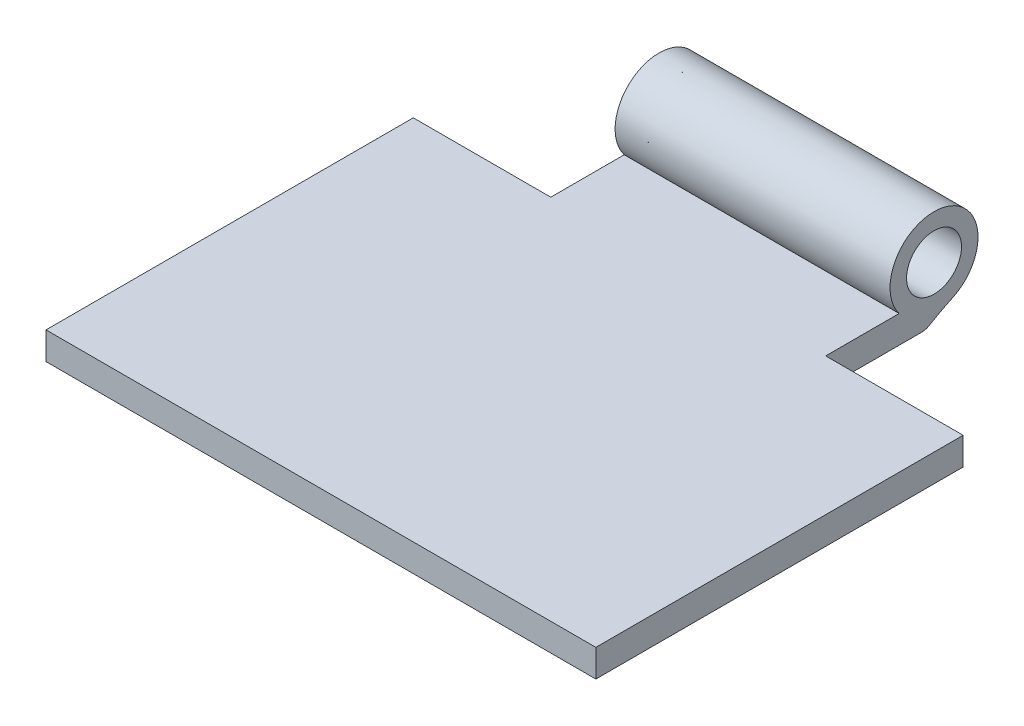
from build123d import *

# Parameters (mm, degrees)
SKETCH1_W           = 20
SKETCH1_H           = 17
BOSS_EXTRUDE1_DEPTH = 1
SKETCH2_R           = 1.6
SKETCH2_R_2         = 1
BOSS_EXTRUDE2_DEPTH = 20
FILLET1_R           = 10
FILLET2_R           = 0.5
SKETCH4_W           = 10
SKETCH4_H           = 12
CUT_EXTRUDE3_DEPTH  = 15.86420015


with BuildPart() as part:
    # Sketch1 → Boss-Extrude1 (new body)
    with BuildSketch(Plane(origin=(0, 0, 0), x_dir=(1, 0, 0), z_dir=(0, 1, 0))):
        Rectangle(SKETCH1_W, SKETCH1_H)
    extrude(amount=BOSS_EXTRUDE1_DEPTH)

    # Sketch2 → Boss-Extrude2 (add)
    with BuildSketch(Plane(origin=(10, 0, 0), x_dir=(0, 0, -1), z_dir=(1, 0, 0))):
        with Locations((8.800384095, 1.974416987)):
            Circle(SKETCH2_R)
        with Locations((8.800384095, 1.974416987)):
            Circle(SKETCH2_R_2, mode=Mode.SUBTRACT)
    extrude(amount=-BOSS_EXTRUDE2_DEPTH)

    # Fillet1
    # the kernel refuses this fillet: 10 mm, written as the material it adds along each edge
    with BuildSketch(Plane(origin=(-10, 0.402866989, -8.5), x_dir=(0, -1, 0), z_dir=(1, 0, 0))) as fillet1_piece_1:
        with BuildLine():
            CenterArc((8.937605274, 5.21135706), FILLET1_R, 205.046884286, 6.361578996)
            Line((-0.12201134, 0.977759676), (-0.303203672, 0.893087728))
            ThreePointArc((-0.303203672, 0.893087728), (-0.18232452, 0.473740867), (-0.19644375, 0.037548012))
            Line((-0.19644375, 0.037548012), (0, -0.2))
            ThreePointArc((0, -0.2), (0.201433495, -0.2), (0.232172223, -0.104227141))
            Line((0.232172223, -0.104227141), (0.402866989, 0))
        make_face()
    extrude(amount=20)

    # Fillet2
    fillet2_edges = [part.edges().sort_by_distance(p)[0] for p in [
        (0, 0, -8.5),
    ]]
    fillet(fillet2_edges, radius=FILLET2_R)

    # Sketch4 → Cut-Extrude3 (cut, through all)
    with BuildSketch(Plane(origin=(0, 0, 0), x_dir=(1, 0, 0), z_dir=(0, 1, 0))):
        with Locations((10, 10.859859008)):
            Rectangle(SKETCH4_W, SKETCH4_H)
        with Locations((-10, 10.859859008)):
            Rectangle(SKETCH4_W, SKETCH4_H)
    extrude(amount=CUT_EXTRUDE3_DEPTH, mode=Mode.SUBTRACT)


solid = part.part
